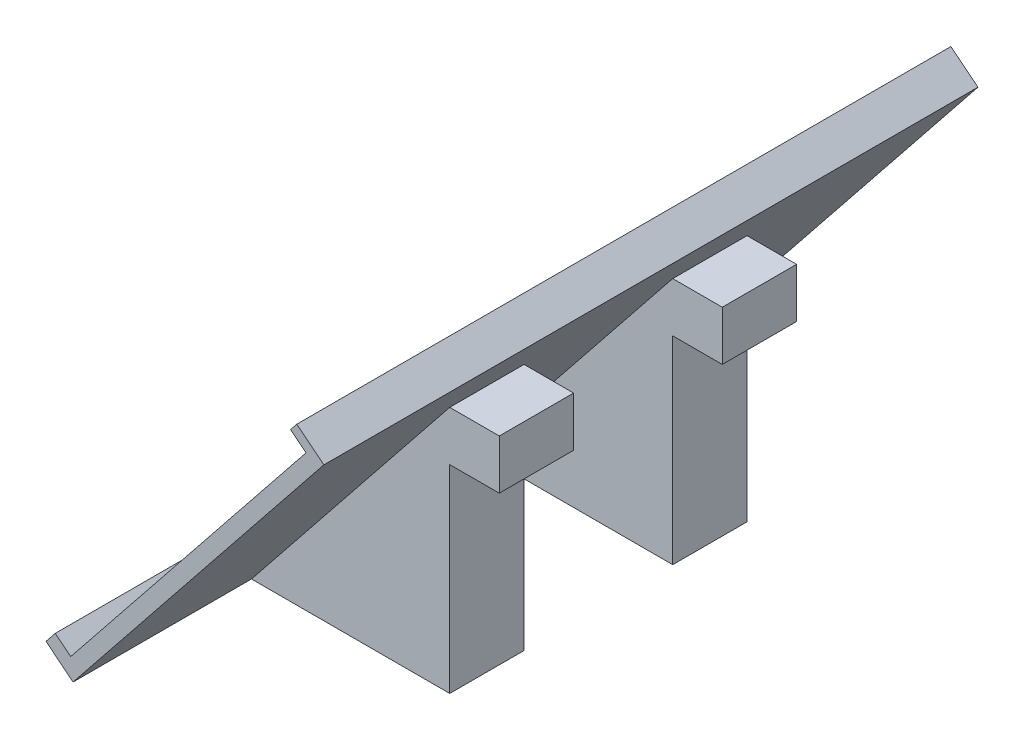
from build123d import *

# Parameters (mm, degrees)
SALIENTE_EXTRUIR1_DEPTH = 60
CORTAR_EXTRUIR1_REACH   = 81.095
CROQUIS2_W              = 30
CROQUIS2_H              = 64.031242374
CROQUIS3_W              = 132
CROQUIS3_H              = 81
SALIENTE_EXTRUIR2_DEPTH = 3
CROQUIS4_W              = 15
CROQUIS4_H              = 10
SALIENTE_EXTRUIR3_DEPTH = 10
CROQUIS5_W              = 132
CROQUIS5_H              = 2
CROQUIS5_H_2            = 3
SALIENTE_EXTRUIR4_DEPTH = 4


with BuildPart() as part:
    # Croquis1 → Saliente-Extruir1 (new body)
    with BuildSketch(Plane.XY):
        Polygon((-20, 0), (20, 0), (20, 50), align=None)
    extrude(amount=SALIENTE_EXTRUIR1_DEPTH)

    # Croquis2 → Cortar-Extruir1 (cut, up to next)
    with BuildSketch(Plane(origin=(-12.195121951, 9.756097561, 0), x_dir=(0, 0, 1), z_dir=(-0.7808688094430303, 0.6246950475544242, 0)), mode=Mode.PRIVATE) as cortar_extruir1_sk1:
        with Locations((30, 19.521720236)):
            Rectangle(CROQUIS2_W, CROQUIS2_H)
    cortar_extruir1_tool1 = extrude(cortar_extruir1_sk1.sketch, amount=-CORTAR_EXTRUIR1_REACH, mode=Mode.PRIVATE) & part.part
    add(cortar_extruir1_tool1.solids().sort_by_distance((0, 25, 30))[0], mode=Mode.SUBTRACT)


with BuildPart() as cortar_extruir1_piece_1:
    # of the separate pieces the step leaves, piece 1, a body of its own (cortar_extruir1_pieces)
    add(part.part.solids().sort_by_distance((-20, 0, 0))[0])



with BuildPart() as cortar_extruir1_piece_2:
    # of the separate pieces the step leaves, piece 2, a body of its own (cortar_extruir1_pieces)
    add(part.part.solids().sort_by_distance((-20, 0, 45))[0])


with BuildPart() as cortar_extruir1_piece_1_1:
    add(cortar_extruir1_piece_1.part)

    add(cortar_extruir1_piece_2.part)  # Saliente-Extruir2 merges Cortar-Extruir1 piece 2
    # Croquis3 → Saliente-Extruir2 (add)
    with BuildSketch(Plane(origin=(-12.195121951, 9.756097561, 0), x_dir=(0, 0, 1), z_dir=(-0.7808688094430304, 0.6246950475544243, 0))):
        with Locations((30, 28.006099049)):
            Rectangle(CROQUIS3_W, CROQUIS3_H)
    extrude(amount=SALIENTE_EXTRUIR2_DEPTH)

    # Croquis4 → Saliente-Extruir3 (add)
    with BuildSketch(Plane(origin=(20, 0, 0), x_dir=(0, 0, -1), z_dir=(1, 0, 0))):
        with Locations((-52.5, 45)):
            Rectangle(CROQUIS4_W, CROQUIS4_H)
        with Locations((-7.5, 45)):
            Rectangle(CROQUIS4_W, CROQUIS4_H)
    extrude(amount=SALIENTE_EXTRUIR3_DEPTH)

    # Croquis5 → Saliente-Extruir4 (add)
    with BuildSketch(Plane(origin=(-14.53772838, 11.630182704, 0), x_dir=(0, 0, 1), z_dir=(-0.7808688094430305, 0.6246950475544242, 0))):
        with Locations((30, 67.506099049)):
            Rectangle(CROQUIS5_W, CROQUIS5_H)
        with Locations((30, -10.993900951)):
            Rectangle(CROQUIS5_W, CROQUIS5_H_2)
    extrude(amount=SALIENTE_EXTRUIR4_DEPTH)


solid = cortar_extruir1_piece_1_1.part
